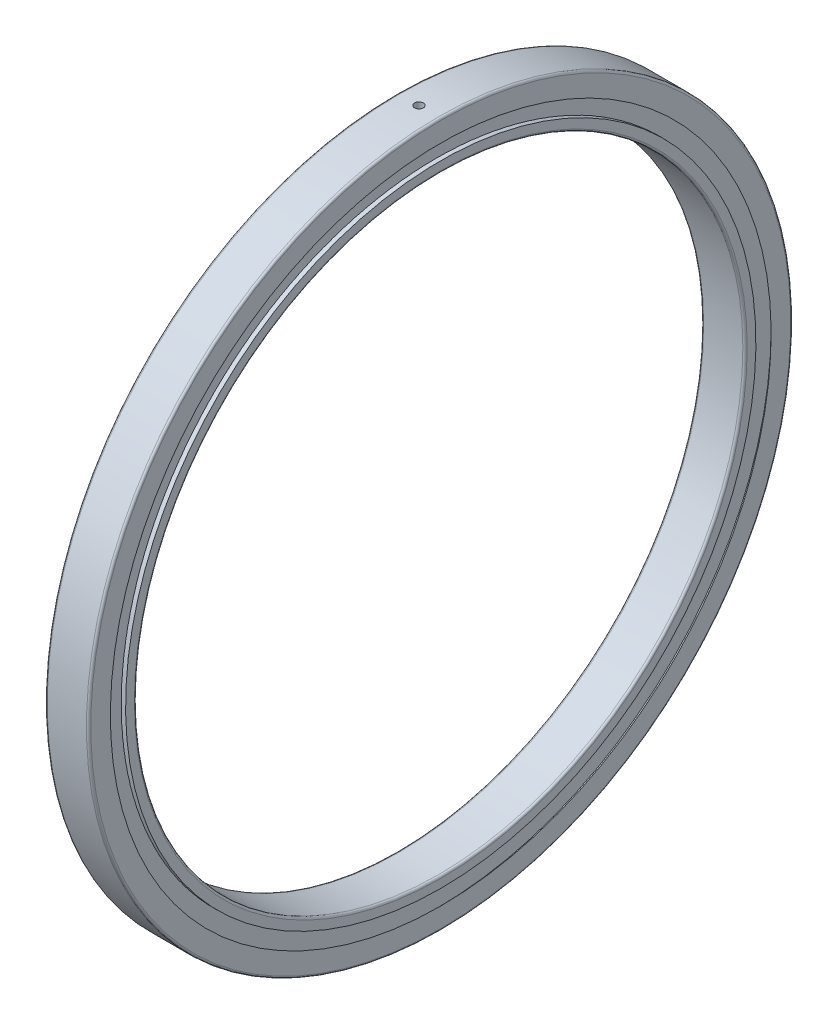
from build123d import *

# Parameters (mm, degrees)
REVOLVE2_OUTLINE_W = 2.25
REVOLVE2_OUTLINE_H = 0.7
SKETCH5_W          = 0.5
SKETCH5_H          = 2
CIRPATTERN1_COUNT  = 2


# Read off the part's stored shape, not the designer's step: Revolve2
with BuildPart() as part:
    # Sketch3 → Revolve1 (revolve)
    with BuildSketch(Plane.XY, mode=Mode.PRIVATE) as revolve1_sk:
        with BuildLine():
            Line((-2, 36.25), (-2.5, 36.25))
            Line((-2.5, 36.25), (-2.5, 35.25))
            ThreePointArc((-2.5, 35.25), (-2.426776695, 35.073223305), (-2.25, 35))
            Line((-2.25, 35), (2.25, 35))
            ThreePointArc((2.25, 35), (2.426776695, 35.073223305), (2.5, 35.25))
            Line((2.5, 35.25), (2.5, 36.25))
            Line((2.5, 36.25), (2, 36.25))
            Line((2, 36.25), (1.3, 36.25))
            Line((1.3, 36.25), (1.3, 38.5))
            Line((1.3, 38.5), (2, 38.5))
            Line((2, 38.5), (2.5, 38))
            Line((2.5, 38), (2.5, 38.5))
            Line((2.5, 38.5), (2.5, 40.25))
            ThreePointArc((2.5, 40.25), (2.426776695, 40.426776695), (2.25, 40.5))
            Line((2.25, 40.5), (-2.25, 40.5))
            ThreePointArc((-2.25, 40.5), (-2.426776695, 40.426776695), (-2.5, 40.25))
            Line((-2.5, 40.25), (-2.5, 38.5))
            Line((-2.5, 38.5), (-2.5, 38))
            Line((-2.5, 38), (-2, 38.5))
            Line((-2, 38.5), (-1.3, 38.5))
            Line((-1.3, 38.5), (-1.3, 36.25))
            Line((-1.3, 36.25), (-2, 36.25))
        make_face()
    revolve(revolve1_sk.sketch.rotate(Axis((-2.5, 0, 0), (1, 0, 0)), 180), axis=Axis((-2.5, 0, 0), (1, 0, 0)))

    # Sketch5 → Cut-Revolve1 (revolve, cut)
    with BuildSketch(Plane.XY, mode=Mode.PRIVATE) as cut_revolve1_sk:
        with Locations((-0.25, 39.5)):
            Rectangle(SKETCH5_W, SKETCH5_H)
    cut_revolve1 = revolve(cut_revolve1_sk.sketch.rotate(Axis((0, 38.5, 0), (0, 1, 0)), 180), axis=Axis((0, 38.5, 0), (0, 1, 0)), mode=Mode.SUBTRACT)

    # CirPattern1: Cut-Revolve1 ×2 about axis
    cirpattern1_axis = Axis((0, 0, 0), (-1, 0, 0))
    for i in range(1, CIRPATTERN1_COUNT):
        add(cut_revolve1.rotate(cirpattern1_axis, i * 360 / CIRPATTERN1_COUNT), mode=Mode.SUBTRACT)


with BuildPart() as body_2:
    # Revolve2 outline → Revolve2 (revolve)
    with BuildSketch(Plane.YX):
        with Locations((37.375, 1.65)):
            Rectangle(REVOLVE2_OUTLINE_W, REVOLVE2_OUTLINE_H)
        with Locations((37.375, -1.65)):
            Rectangle(REVOLVE2_OUTLINE_W, REVOLVE2_OUTLINE_H)
    revolve(axis=Axis((0, 0, 0), (1, 0, 0)))


solid = Compound([part.part, body_2.part])
